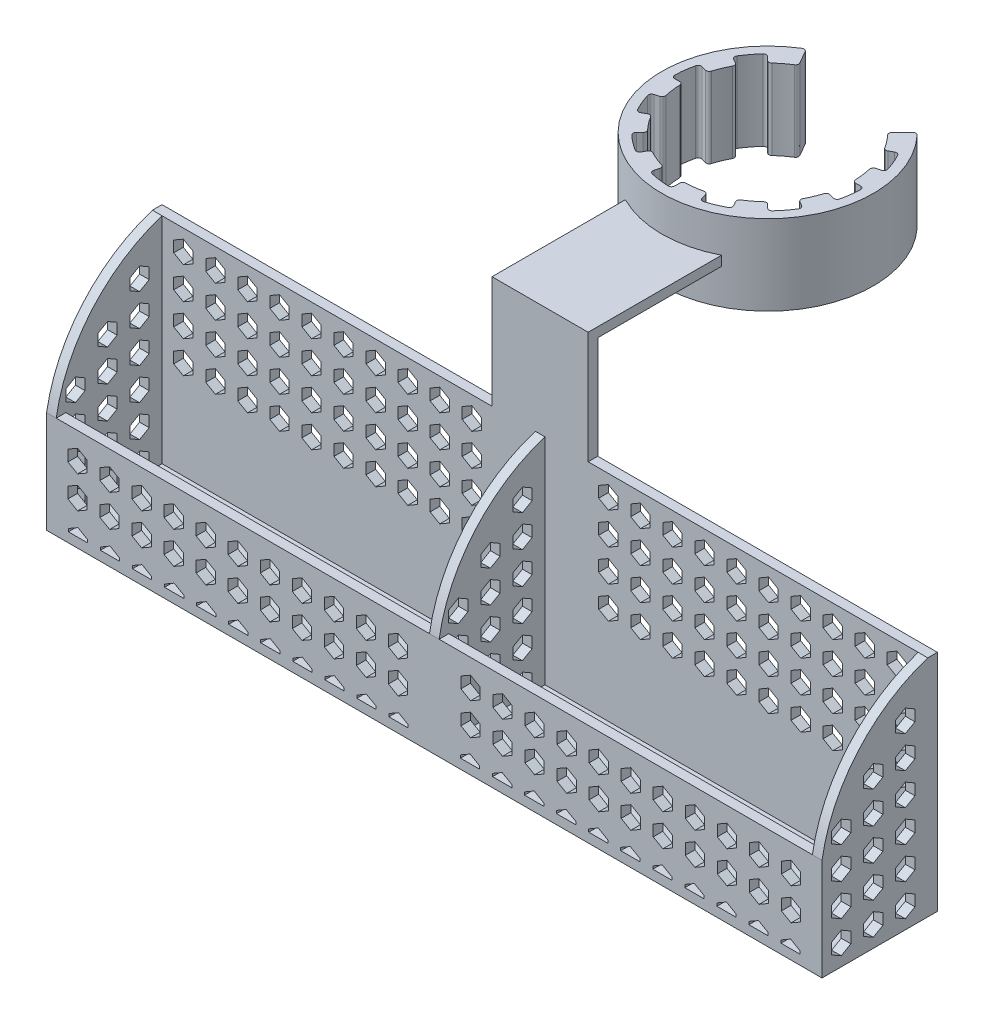
from build123d import *

# Parameters (mm, degrees)
BOSS_EXTRUDE1_DEPTH        = 25
BOSS_EXTRUDE2_REACH        = 89.943
BOSS_EXTRUDE2_START_RADIUS = 33
BOSS_EXTRUDE2_END_RADIUS   = 33
SKETCH4_W                  = 30
SKETCH4_H                  = 3
BOSS_EXTRUDE3_DEPTH        = 3
BOSS_EXTRUDE4_DEPTH        = 105
SKETCH9_W                  = 102.956738561
SKETCH9_H                  = 70
BOSS_EXTRUDE5_DEPTH        = 3
BOSS_EXTRUDE8_DEPTH        = 30
BOSS_EXTRUDE8_DEPTH_BACK   = 3
SKETCH14_W                 = 241.913477122
SKETCH14_H                 = 70
BOSS_EXTRUDE10_DEPTH       = 3
CUT_EXTRUDE1_DEPTH         = 30
CUT_EXTRUDE2_DEPTH         = 250
CUT_EXTRUDE3_REACH         = 202.968
SKETCH16_W                 = 235.913477122
SKETCH16_H                 = 12.238805489
SKETCH17_W                 = 241.913477122
SKETCH17_H                 = 1.732050807
BOSS_EXTRUDE11_DEPTH       = 3
SKETCH19_W                 = 3
SKETCH19_H                 = 33
BOSS_EXTRUDE12_DEPTH       = 67
CUT_EXTRUDE4_REACH         = 280.602
CUT_EXTRUDE5_DEPTH         = 259


with BuildPart() as part:
    # Sketch2 → Boss-Extrude1 (new body)
    with BuildSketch(Plane(origin=(0, 0, 0), x_dir=(1, 0, 0), z_dir=(0, 1, 0))):
        with BuildLine():
            Line((19.432575743, 19.432575743), (20.493901532, 20.493901532))
            Line((20.493901532, 20.493901532), (22.616365756, 22.616365756))
            ThreePointArc((22.616365756, 22.616365756), (23.339099445, 22.909136867), (24.052331054, 22.593923318))
            ThreePointArc((24.052331054, 22.593923318), (-4.307364343, -32.717680425), (-17.385030089, 28.049255405))
            ThreePointArc((-17.385030089, 28.049255405), (-16.614517988, 28.16913039), (-15.992185592, 27.699277969))
            Line((-15.992185592, 27.699277969), (-13.740906084, 23.799947479))
            ThreePointArc((-13.740906084, 23.799947479), (-13.636458805, 23.058736424), (-14.075770342, 22.452676662))
            ThreePointArc((-14.075770342, 22.452676662), (-16.132177869, 21.023863518), (-18.044542818, 19.407330432))
            ThreePointArc((-18.044542818, 19.407330432), (-18.743653787, 19.139847882), (-19.432575743, 19.432575743))
            Line((-19.432575743, 19.432575743), (-20.493901532, 20.493901532))
            ThreePointArc((-20.493901532, 20.493901532), (-21.218252256, 20.786646063), (-21.932077565, 20.469098018))
            ThreePointArc((-21.932077565, 20.469098018), (-23.800600209, 18.26284287), (-25.448069789, 15.886967741))
            ThreePointArc((-25.448069789, 15.886967741), (-25.570046062, 15.115277958), (-25.099800796, 14.491376746))
            Line((-25.099800796, 14.491376746), (-23.799947479, 13.740906084))
            ThreePointArc((-23.799947479, 13.740906084), (-23.338887955, 13.15122212), (-23.416313025, 12.406703201))
            ThreePointArc((-23.416313025, 12.406703201), (-24.482807612, 10.141110958), (-25.330697696, 7.784969765))
            ThreePointArc((-25.330697696, 7.784969765), (-25.80240428, 7.203767597), (-26.545392126, 7.112816383))
            Line((-26.545392126, 7.112816383), (-27.995190115, 7.501288583))
            ThreePointArc((-27.995190115, 7.501288583), (-28.768868509, 7.392637422), (-29.228285338, 6.760720094))
            ThreePointArc((-29.228285338, 6.760720094), (-29.743345841, 3.915785767), (-29.982158785, 1.034482759))
            ThreePointArc((-29.982158785, 1.034482759), (-29.701948445, 0.305191666), (-28.982753492, 0))
            Line((-28.982753492, 0), (-27.481812167, 0))
            ThreePointArc((-27.481812167, 0), (-26.787680925, -0.280151531), (-26.482473543, -0.963636364))
            ThreePointArc((-26.482473543, -0.963636364), (-26.273288826, -3.458944094), (-25.829512583, -5.923367264))
            ThreePointArc((-25.829512583, -5.923367264), (-25.947421383, -6.662556398), (-26.545392126, -7.112816383))
            Line((-26.545392126, -7.112816383), (-27.995190115, -7.501288583))
            ThreePointArc((-27.995190115, -7.501288583), (-28.610889678, -7.982222446), (-28.692797659, -8.75918732))
            ThreePointArc((-28.692797659, -8.75918732), (-27.716385975, -11.480502971), (-26.482552548, -14.095191044))
            ThreePointArc((-26.482552548, -14.095191044), (-25.875237728, -14.586670486), (-25.099800796, -14.491376746))
            Line((-25.099800796, -14.491376746), (-23.799947479, -13.740906084))
            ThreePointArc((-23.799947479, -13.740906084), (-23.058736424, -13.636458805), (-22.452676662, -14.075770342))
            ThreePointArc((-22.452676662, -14.075770342), (-21.023863518, -16.132177869), (-19.407330432, -18.044542818))
            ThreePointArc((-19.407330432, -18.044542818), (-19.139847882, -18.743653787), (-19.432575743, -19.432575743))
            Line((-19.432575743, -19.432575743), (-20.493901532, -20.493901532))
            ThreePointArc((-20.493901532, -20.493901532), (-20.786646063, -21.218252256), (-20.469098018, -21.932077565))
            ThreePointArc((-20.469098018, -21.932077565), (-18.26284287, -23.800600209), (-15.886967741, -25.448069789))
            ThreePointArc((-15.886967741, -25.448069789), (-15.115277958, -25.570046062), (-14.491376746, -25.099800796))
            Line((-14.491376746, -25.099800796), (-13.740906084, -23.799947479))
            ThreePointArc((-13.740906084, -23.799947479), (-13.15122212, -23.338887955), (-12.406703201, -23.416313025))
            ThreePointArc((-12.406703201, -23.416313025), (-10.141110958, -24.482807612), (-7.784969765, -25.330697696))
            ThreePointArc((-7.784969765, -25.330697696), (-7.203767597, -25.80240428), (-7.112816383, -26.545392126))
            Line((-7.112816383, -26.545392126), (-7.501288583, -27.995190115))
            ThreePointArc((-7.501288583, -27.995190115), (-7.392637422, -28.768868509), (-6.760720094, -29.228285338))
            ThreePointArc((-6.760720094, -29.228285338), (-3.915785767, -29.743345841), (-1.034482759, -29.982158785))
            ThreePointArc((-1.034482759, -29.982158785), (-0.305191666, -29.701948445), (0, -28.982753492))
            Line((0, -28.982753492), (0, -27.481812167))
            ThreePointArc((0, -27.481812167), (0.280151531, -26.787680925), (0.963636364, -26.482473543))
            ThreePointArc((0.963636364, -26.482473543), (3.458944094, -26.273288826), (5.923367264, -25.829512583))
            ThreePointArc((5.923367264, -25.829512583), (6.662556398, -25.947421383), (7.112816383, -26.545392126))
            Line((7.112816383, -26.545392126), (7.501288583, -27.995190115))
            ThreePointArc((7.501288583, -27.995190115), (7.982222446, -28.610889678), (8.75918732, -28.692797659))
            ThreePointArc((8.75918732, -28.692797659), (11.480502971, -27.716385975), (14.095191044, -26.482552548))
            ThreePointArc((14.095191044, -26.482552548), (14.586670486, -25.875237728), (14.491376746, -25.099800796))
            Line((14.491376746, -25.099800796), (13.740906084, -23.799947479))
            ThreePointArc((13.740906084, -23.799947479), (13.636458805, -23.058736424), (14.075770342, -22.452676662))
            ThreePointArc((14.075770342, -22.452676662), (16.132177869, -21.023863518), (18.044542818, -19.407330432))
            ThreePointArc((18.044542818, -19.407330432), (18.743653787, -19.139847882), (19.432575743, -19.432575743))
            Line((19.432575743, -19.432575743), (20.493901532, -20.493901532))
            ThreePointArc((20.493901532, -20.493901532), (21.218252256, -20.786646063), (21.932077565, -20.469098018))
            ThreePointArc((21.932077565, -20.469098018), (23.800600209, -18.26284287), (25.448069789, -15.886967741))
            ThreePointArc((25.448069789, -15.886967741), (25.570046062, -15.115277958), (25.099800796, -14.491376746))
            Line((25.099800796, -14.491376746), (23.799947479, -13.740906084))
            ThreePointArc((23.799947479, -13.740906084), (23.338887955, -13.15122212), (23.416313025, -12.406703201))
            ThreePointArc((23.416313025, -12.406703201), (24.482807612, -10.141110958), (25.330697696, -7.784969765))
            ThreePointArc((25.330697696, -7.784969765), (25.80240428, -7.203767597), (26.545392126, -7.112816383))
            Line((26.545392126, -7.112816383), (27.995190115, -7.501288583))
            ThreePointArc((27.995190115, -7.501288583), (28.768868509, -7.392637422), (29.228285338, -6.760720094))
            ThreePointArc((29.228285338, -6.760720094), (29.743345841, -3.915785767), (29.982158785, -1.034482759))
            ThreePointArc((29.982158785, -1.034482759), (29.701948445, -0.305191666), (28.982753492, 0))
            Line((28.982753492, 0), (27.481812167, 0))
            ThreePointArc((27.481812167, 0), (26.787680925, 0.280151531), (26.482473543, 0.963636364))
            ThreePointArc((26.482473543, 0.963636364), (26.273288826, 3.458944094), (25.829512583, 5.923367264))
            ThreePointArc((25.829512583, 5.923367264), (25.947421383, 6.662556398), (26.545392126, 7.112816383))
            Line((26.545392126, 7.112816383), (27.995190115, 7.501288583))
            ThreePointArc((27.995190115, 7.501288583), (28.610889678, 7.982222446), (28.692797659, 8.75918732))
            ThreePointArc((28.692797659, 8.75918732), (27.716385975, 11.480502971), (26.482552548, 14.095191044))
            ThreePointArc((26.482552548, 14.095191044), (25.875237728, 14.586670486), (25.099800796, 14.491376746))
            Line((25.099800796, 14.491376746), (23.799947479, 13.740906084))
            ThreePointArc((23.799947479, 13.740906084), (23.058736424, 13.636458805), (22.452676662, 14.075770342))
            ThreePointArc((22.452676662, 14.075770342), (21.023863518, 16.132177869), (19.407330432, 18.044542818))
            ThreePointArc((19.407330432, 18.044542818), (19.139847882, 18.743653787), (19.432575743, 19.432575743))
        make_face()
    extrude(amount=BOSS_EXTRUDE1_DEPTH)

    # Boss-Extrude2: from a cylinder face, 89.943 long prism both ways, kept between that surface and its translate by the depth
    boss_extrude2_start = Plane(origin=(0, 12.5, 0), z_dir=(0, -1, 0)) * Cylinder(BOSS_EXTRUDE2_START_RADIUS, 246.886, mode=Mode.PRIVATE)
    boss_extrude2_end = Plane(origin=(0, 12.5, 35), z_dir=(0, -1, 0)) * Cylinder(BOSS_EXTRUDE2_END_RADIUS, 246.886, mode=Mode.PRIVATE)
    # Sketch4 → Boss-Extrude2 (add, from a surface)
    with BuildSketch(Plane.XY, mode=Mode.PRIVATE) as boss_extrude2_sk1:
        with Locations((0, 12.5)):
            Rectangle(SKETCH4_W, SKETCH4_H)
    boss_extrude2_tool1 = extrude(boss_extrude2_sk1.sketch, amount=BOSS_EXTRUDE2_REACH, both=True, mode=Mode.PRIVATE)
    add(((boss_extrude2_tool1 - boss_extrude2_start) & boss_extrude2_end).solids().sort_by_distance((0, 12.5, 46.893877))[0])

    # Sketch5 → Boss-Extrude3 (add)
    with BuildSketch(Plane(origin=(0, 14, 0), x_dir=(1, 0, 0), z_dir=(0, 1, 0))):
        Polygon((0, -68), (-15, -68), (-15, -64.393876913), (15, -64.393876913), (15, -68), align=None)
    extrude(amount=-BOSS_EXTRUDE3_DEPTH)

    # Sketch6 → Boss-Extrude4 (add)
    with BuildSketch(Plane(origin=(0, 14, 0), x_dir=(1, 0, 0), z_dir=(0, 1, 0))):
        Polygon((0, -68), (-15, -68), (-15, -71), (15, -71), (15, -68), align=None)
    extrude(amount=-BOSS_EXTRUDE4_DEPTH)

    # Sketch9 → Boss-Extrude5 (add)
    # profile 1 of 2: a face of its own
    with BuildSketch(Plane.XY.offset(71)):
        with Locations((-66.478369281, -56)):
            Rectangle(SKETCH9_W, SKETCH9_H)
        Polygon((-101.299929178, -24), (-104.299929178, -25.732050808), (-104.299929178, -29.196152423), (-101.299929178, -30.92820323), (-98.299929178, -29.196152423), (-98.299929178, -25.732050808), align=None, mode=Mode.SUBTRACT)
        Polygon((-111.299929178, -24), (-114.299929178, -25.732050808), (-114.299929178, -29.196152423), (-111.299929178, -30.92820323), (-108.299929178, -29.196152423), (-108.299929178, -25.732050808), align=None, mode=Mode.SUBTRACT)
        Polygon((-91.299929178, -24), (-94.299929178, -25.732050808), (-94.299929178, -29.196152423), (-91.299929178, -30.92820323), (-88.299929178, -29.196152423), (-88.299929178, -25.732050808), align=None, mode=Mode.SUBTRACT)
        Polygon((-81.299929178, -24), (-84.299929178, -25.732050808), (-84.299929178, -29.196152423), (-81.299929178, -30.92820323), (-78.299929178, -29.196152423), (-78.299929178, -25.732050808), align=None, mode=Mode.SUBTRACT)
        Polygon((-71.299929178, -24), (-74.299929178, -25.732050808), (-74.299929178, -29.196152423), (-71.299929178, -30.92820323), (-68.299929178, -29.196152423), (-68.299929178, -25.732050808), align=None, mode=Mode.SUBTRACT)
        Polygon((-61.299929178, -24), (-64.299929178, -25.732050808), (-64.299929178, -29.196152423), (-61.299929178, -30.92820323), (-58.299929178, -29.196152423), (-58.299929178, -25.732050808), align=None, mode=Mode.SUBTRACT)
        Polygon((-51.299929178, -24), (-54.299929178, -25.732050808), (-54.299929178, -29.196152423), (-51.299929178, -30.92820323), (-48.299929178, -29.196152423), (-48.299929178, -25.732050808), align=None, mode=Mode.SUBTRACT)
        Polygon((-41.299929178, -24), (-44.299929178, -25.732050808), (-44.299929178, -29.196152423), (-41.299929178, -30.92820323), (-38.299929178, -29.196152423), (-38.299929178, -25.732050808), align=None, mode=Mode.SUBTRACT)
        Polygon((-31.299929178, -24), (-34.299929178, -25.732050808), (-34.299929178, -29.196152423), (-31.299929178, -30.92820323), (-28.299929178, -29.196152423), (-28.299929178, -25.732050808), align=None, mode=Mode.SUBTRACT)
        Polygon((-21.299929178, -24), (-24.299929178, -25.732050808), (-24.299929178, -29.196152423), (-21.299929178, -30.92820323), (-18.299929178, -29.196152423), (-18.299929178, -25.732050808), align=None, mode=Mode.SUBTRACT)
        Polygon((-101.299929178, -34), (-104.299929178, -35.732050808), (-104.299929178, -39.196152423), (-101.299929178, -40.92820323), (-98.299929178, -39.196152423), (-98.299929178, -35.732050808), align=None, mode=Mode.SUBTRACT)
        Polygon((-91.299929178, -34), (-94.299929178, -35.732050808), (-94.299929178, -39.196152423), (-91.299929178, -40.92820323), (-88.299929178, -39.196152423), (-88.299929178, -35.732050808), align=None, mode=Mode.SUBTRACT)
        Polygon((-81.299929178, -34), (-84.299929178, -35.732050808), (-84.299929178, -39.196152423), (-81.299929178, -40.92820323), (-78.299929178, -39.196152423), (-78.299929178, -35.732050808), align=None, mode=Mode.SUBTRACT)
        Polygon((-71.299929178, -34), (-74.299929178, -35.732050808), (-74.299929178, -39.196152423), (-71.299929178, -40.92820323), (-68.299929178, -39.196152423), (-68.299929178, -35.732050808), align=None, mode=Mode.SUBTRACT)
        Polygon((-61.299929178, -34), (-64.299929178, -35.732050808), (-64.299929178, -39.196152423), (-61.299929178, -40.92820323), (-58.299929178, -39.196152423), (-58.299929178, -35.732050808), align=None, mode=Mode.SUBTRACT)
        Polygon((-51.299929178, -34), (-54.299929178, -35.732050808), (-54.299929178, -39.196152423), (-51.299929178, -40.92820323), (-48.299929178, -39.196152423), (-48.299929178, -35.732050808), align=None, mode=Mode.SUBTRACT)
        Polygon((-41.299929178, -34), (-44.299929178, -35.732050808), (-44.299929178, -39.196152423), (-41.299929178, -40.92820323), (-38.299929178, -39.196152423), (-38.299929178, -35.732050808), align=None, mode=Mode.SUBTRACT)
        Polygon((-31.299929178, -34), (-34.299929178, -35.732050808), (-34.299929178, -39.196152423), (-31.299929178, -40.92820323), (-28.299929178, -39.196152423), (-28.299929178, -35.732050808), align=None, mode=Mode.SUBTRACT)
        Polygon((-21.299929178, -34), (-24.299929178, -35.732050808), (-24.299929178, -39.196152423), (-21.299929178, -40.92820323), (-18.299929178, -39.196152423), (-18.299929178, -35.732050808), align=None, mode=Mode.SUBTRACT)
        Polygon((-101.299929178, -44), (-104.299929178, -45.732050808), (-104.299929178, -49.196152423), (-101.299929178, -50.92820323), (-98.299929178, -49.196152423), (-98.299929178, -45.732050808), align=None, mode=Mode.SUBTRACT)
        Polygon((-91.299929178, -44), (-94.299929178, -45.732050808), (-94.299929178, -49.196152423), (-91.299929178, -50.92820323), (-88.299929178, -49.196152423), (-88.299929178, -45.732050808), align=None, mode=Mode.SUBTRACT)
        Polygon((-81.299929178, -44), (-84.299929178, -45.732050808), (-84.299929178, -49.196152423), (-81.299929178, -50.92820323), (-78.299929178, -49.196152423), (-78.299929178, -45.732050808), align=None, mode=Mode.SUBTRACT)
        Polygon((-71.299929178, -44), (-74.299929178, -45.732050808), (-74.299929178, -49.196152423), (-71.299929178, -50.92820323), (-68.299929178, -49.196152423), (-68.299929178, -45.732050808), align=None, mode=Mode.SUBTRACT)
        Polygon((-61.299929178, -44), (-64.299929178, -45.732050808), (-64.299929178, -49.196152423), (-61.299929178, -50.92820323), (-58.299929178, -49.196152423), (-58.299929178, -45.732050808), align=None, mode=Mode.SUBTRACT)
        Polygon((-51.299929178, -44), (-54.299929178, -45.732050808), (-54.299929178, -49.196152423), (-51.299929178, -50.92820323), (-48.299929178, -49.196152423), (-48.299929178, -45.732050808), align=None, mode=Mode.SUBTRACT)
        Polygon((-41.299929178, -44), (-44.299929178, -45.732050808), (-44.299929178, -49.196152423), (-41.299929178, -50.92820323), (-38.299929178, -49.196152423), (-38.299929178, -45.732050808), align=None, mode=Mode.SUBTRACT)
        Polygon((-31.299929178, -44), (-34.299929178, -45.732050808), (-34.299929178, -49.196152423), (-31.299929178, -50.92820323), (-28.299929178, -49.196152423), (-28.299929178, -45.732050808), align=None, mode=Mode.SUBTRACT)
        Polygon((-21.299929178, -44), (-24.299929178, -45.732050808), (-24.299929178, -49.196152423), (-21.299929178, -50.92820323), (-18.299929178, -49.196152423), (-18.299929178, -45.732050808), align=None, mode=Mode.SUBTRACT)
        Polygon((-101.299929178, -54), (-104.299929178, -55.732050808), (-104.299929178, -59.196152423), (-101.299929178, -60.92820323), (-98.299929178, -59.196152423), (-98.299929178, -55.732050808), align=None, mode=Mode.SUBTRACT)
        Polygon((-91.299929178, -54), (-94.299929178, -55.732050808), (-94.299929178, -59.196152423), (-91.299929178, -60.92820323), (-88.299929178, -59.196152423), (-88.299929178, -55.732050808), align=None, mode=Mode.SUBTRACT)
        Polygon((-81.299929178, -54), (-84.299929178, -55.732050808), (-84.299929178, -59.196152423), (-81.299929178, -60.92820323), (-78.299929178, -59.196152423), (-78.299929178, -55.732050808), align=None, mode=Mode.SUBTRACT)
        Polygon((-71.299929178, -54), (-74.299929178, -55.732050808), (-74.299929178, -59.196152423), (-71.299929178, -60.92820323), (-68.299929178, -59.196152423), (-68.299929178, -55.732050808), align=None, mode=Mode.SUBTRACT)
        Polygon((-61.299929178, -54), (-64.299929178, -55.732050808), (-64.299929178, -59.196152423), (-61.299929178, -60.92820323), (-58.299929178, -59.196152423), (-58.299929178, -55.732050808), align=None, mode=Mode.SUBTRACT)
        Polygon((-51.299929178, -54), (-54.299929178, -55.732050808), (-54.299929178, -59.196152423), (-51.299929178, -60.92820323), (-48.299929178, -59.196152423), (-48.299929178, -55.732050808), align=None, mode=Mode.SUBTRACT)
        Polygon((-41.299929178, -54), (-44.299929178, -55.732050808), (-44.299929178, -59.196152423), (-41.299929178, -60.92820323), (-38.299929178, -59.196152423), (-38.299929178, -55.732050808), align=None, mode=Mode.SUBTRACT)
        Polygon((-31.299929178, -54), (-34.299929178, -55.732050808), (-34.299929178, -59.196152423), (-31.299929178, -60.92820323), (-28.299929178, -59.196152423), (-28.299929178, -55.732050808), align=None, mode=Mode.SUBTRACT)
        Polygon((-21.299929178, -54), (-24.299929178, -55.732050808), (-24.299929178, -59.196152423), (-21.299929178, -60.92820323), (-18.299929178, -59.196152423), (-18.299929178, -55.732050808), align=None, mode=Mode.SUBTRACT)
        Polygon((-111.299929178, -34), (-114.299929178, -35.732050808), (-114.299929178, -39.196152423), (-111.299929178, -40.92820323), (-108.299929178, -39.196152423), (-108.299929178, -35.732050808), align=None, mode=Mode.SUBTRACT)
        Polygon((-111.299929178, -44), (-114.299929178, -45.732050808), (-114.299929178, -49.196152423), (-111.299929178, -50.92820323), (-108.299929178, -49.196152423), (-108.299929178, -45.732050808), align=None, mode=Mode.SUBTRACT)
        Polygon((-111.299929178, -54), (-114.299929178, -55.732050808), (-114.299929178, -59.196152423), (-111.299929178, -60.92820323), (-108.299929178, -59.196152423), (-108.299929178, -55.732050808), align=None, mode=Mode.SUBTRACT)
    # profile 2 of 2: a face of its own
    with BuildSketch(Plane.XY.offset(71)):
        with Locations((66.478369281, -56)):
            Rectangle(SKETCH9_W, SKETCH9_H)
        Polygon((108.299929178, -55.732050808), (111.299929178, -54), (114.299929178, -55.732050808), (114.299929178, -59.196152423), (111.299929178, -60.92820323), (108.299929178, -59.196152423), align=None, mode=Mode.SUBTRACT)
        Polygon((108.299929178, -45.732050808), (111.299929178, -44), (114.299929178, -45.732050808), (114.299929178, -49.196152423), (111.299929178, -50.92820323), (108.299929178, -49.196152423), align=None, mode=Mode.SUBTRACT)
        Polygon((108.299929178, -35.732050808), (111.299929178, -34), (114.299929178, -35.732050808), (114.299929178, -39.196152423), (111.299929178, -40.92820323), (108.299929178, -39.196152423), align=None, mode=Mode.SUBTRACT)
        Polygon((18.299929178, -55.732050808), (21.299929178, -54), (24.299929178, -55.732050808), (24.299929178, -59.196152423), (21.299929178, -60.92820323), (18.299929178, -59.196152423), align=None, mode=Mode.SUBTRACT)
        Polygon((28.299929178, -55.732050808), (31.299929178, -54), (34.299929178, -55.732050808), (34.299929178, -59.196152423), (31.299929178, -60.92820323), (28.299929178, -59.196152423), align=None, mode=Mode.SUBTRACT)
        Polygon((38.299929178, -55.732050808), (41.299929178, -54), (44.299929178, -55.732050808), (44.299929178, -59.196152423), (41.299929178, -60.92820323), (38.299929178, -59.196152423), align=None, mode=Mode.SUBTRACT)
        Polygon((48.299929178, -55.732050808), (51.299929178, -54), (54.299929178, -55.732050808), (54.299929178, -59.196152423), (51.299929178, -60.92820323), (48.299929178, -59.196152423), align=None, mode=Mode.SUBTRACT)
        Polygon((58.299929178, -55.732050808), (61.299929178, -54), (64.299929178, -55.732050808), (64.299929178, -59.196152423), (61.299929178, -60.92820323), (58.299929178, -59.196152423), align=None, mode=Mode.SUBTRACT)
        Polygon((68.299929178, -55.732050808), (71.299929178, -54), (74.299929178, -55.732050808), (74.299929178, -59.196152423), (71.299929178, -60.92820323), (68.299929178, -59.196152423), align=None, mode=Mode.SUBTRACT)
        Polygon((78.299929178, -55.732050808), (81.299929178, -54), (84.299929178, -55.732050808), (84.299929178, -59.196152423), (81.299929178, -60.92820323), (78.299929178, -59.196152423), align=None, mode=Mode.SUBTRACT)
        Polygon((88.299929178, -55.732050808), (91.299929178, -54), (94.299929178, -55.732050808), (94.299929178, -59.196152423), (91.299929178, -60.92820323), (88.299929178, -59.196152423), align=None, mode=Mode.SUBTRACT)
        Polygon((98.299929178, -55.732050808), (101.299929178, -54), (104.299929178, -55.732050808), (104.299929178, -59.196152423), (101.299929178, -60.92820323), (98.299929178, -59.196152423), align=None, mode=Mode.SUBTRACT)
        Polygon((18.299929178, -45.732050808), (21.299929178, -44), (24.299929178, -45.732050808), (24.299929178, -49.196152423), (21.299929178, -50.92820323), (18.299929178, -49.196152423), align=None, mode=Mode.SUBTRACT)
        Polygon((28.299929178, -45.732050808), (31.299929178, -44), (34.299929178, -45.732050808), (34.299929178, -49.196152423), (31.299929178, -50.92820323), (28.299929178, -49.196152423), align=None, mode=Mode.SUBTRACT)
        Polygon((38.299929178, -45.732050808), (41.299929178, -44), (44.299929178, -45.732050808), (44.299929178, -49.196152423), (41.299929178, -50.92820323), (38.299929178, -49.196152423), align=None, mode=Mode.SUBTRACT)
        Polygon((48.299929178, -45.732050808), (51.299929178, -44), (54.299929178, -45.732050808), (54.299929178, -49.196152423), (51.299929178, -50.92820323), (48.299929178, -49.196152423), align=None, mode=Mode.SUBTRACT)
        Polygon((58.299929178, -45.732050808), (61.299929178, -44), (64.299929178, -45.732050808), (64.299929178, -49.196152423), (61.299929178, -50.92820323), (58.299929178, -49.196152423), align=None, mode=Mode.SUBTRACT)
        Polygon((68.299929178, -45.732050808), (71.299929178, -44), (74.299929178, -45.732050808), (74.299929178, -49.196152423), (71.299929178, -50.92820323), (68.299929178, -49.196152423), align=None, mode=Mode.SUBTRACT)
        Polygon((78.299929178, -45.732050808), (81.299929178, -44), (84.299929178, -45.732050808), (84.299929178, -49.196152423), (81.299929178, -50.92820323), (78.299929178, -49.196152423), align=None, mode=Mode.SUBTRACT)
        Polygon((88.299929178, -45.732050808), (91.299929178, -44), (94.299929178, -45.732050808), (94.299929178, -49.196152423), (91.299929178, -50.92820323), (88.299929178, -49.196152423), align=None, mode=Mode.SUBTRACT)
        Polygon((98.299929178, -45.732050808), (101.299929178, -44), (104.299929178, -45.732050808), (104.299929178, -49.196152423), (101.299929178, -50.92820323), (98.299929178, -49.196152423), align=None, mode=Mode.SUBTRACT)
        Polygon((18.299929178, -35.732050808), (21.299929178, -34), (24.299929178, -35.732050808), (24.299929178, -39.196152423), (21.299929178, -40.92820323), (18.299929178, -39.196152423), align=None, mode=Mode.SUBTRACT)
        Polygon((28.299929178, -35.732050808), (31.299929178, -34), (34.299929178, -35.732050808), (34.299929178, -39.196152423), (31.299929178, -40.92820323), (28.299929178, -39.196152423), align=None, mode=Mode.SUBTRACT)
        Polygon((38.299929178, -35.732050808), (41.299929178, -34), (44.299929178, -35.732050808), (44.299929178, -39.196152423), (41.299929178, -40.92820323), (38.299929178, -39.196152423), align=None, mode=Mode.SUBTRACT)
        Polygon((48.299929178, -35.732050808), (51.299929178, -34), (54.299929178, -35.732050808), (54.299929178, -39.196152423), (51.299929178, -40.92820323), (48.299929178, -39.196152423), align=None, mode=Mode.SUBTRACT)
        Polygon((58.299929178, -35.732050808), (61.299929178, -34), (64.299929178, -35.732050808), (64.299929178, -39.196152423), (61.299929178, -40.92820323), (58.299929178, -39.196152423), align=None, mode=Mode.SUBTRACT)
        Polygon((68.299929178, -35.732050808), (71.299929178, -34), (74.299929178, -35.732050808), (74.299929178, -39.196152423), (71.299929178, -40.92820323), (68.299929178, -39.196152423), align=None, mode=Mode.SUBTRACT)
        Polygon((78.299929178, -35.732050808), (81.299929178, -34), (84.299929178, -35.732050808), (84.299929178, -39.196152423), (81.299929178, -40.92820323), (78.299929178, -39.196152423), align=None, mode=Mode.SUBTRACT)
        Polygon((88.299929178, -35.732050808), (91.299929178, -34), (94.299929178, -35.732050808), (94.299929178, -39.196152423), (91.299929178, -40.92820323), (88.299929178, -39.196152423), align=None, mode=Mode.SUBTRACT)
        Polygon((98.299929178, -35.732050808), (101.299929178, -34), (104.299929178, -35.732050808), (104.299929178, -39.196152423), (101.299929178, -40.92820323), (98.299929178, -39.196152423), align=None, mode=Mode.SUBTRACT)
        Polygon((18.299929178, -25.732050808), (21.299929178, -24), (24.299929178, -25.732050808), (24.299929178, -29.196152423), (21.299929178, -30.92820323), (18.299929178, -29.196152423), align=None, mode=Mode.SUBTRACT)
        Polygon((28.299929178, -25.732050808), (31.299929178, -24), (34.299929178, -25.732050808), (34.299929178, -29.196152423), (31.299929178, -30.92820323), (28.299929178, -29.196152423), align=None, mode=Mode.SUBTRACT)
        Polygon((38.299929178, -25.732050808), (41.299929178, -24), (44.299929178, -25.732050808), (44.299929178, -29.196152423), (41.299929178, -30.92820323), (38.299929178, -29.196152423), align=None, mode=Mode.SUBTRACT)
        Polygon((48.299929178, -25.732050808), (51.299929178, -24), (54.299929178, -25.732050808), (54.299929178, -29.196152423), (51.299929178, -30.92820323), (48.299929178, -29.196152423), align=None, mode=Mode.SUBTRACT)
        Polygon((58.299929178, -25.732050808), (61.299929178, -24), (64.299929178, -25.732050808), (64.299929178, -29.196152423), (61.299929178, -30.92820323), (58.299929178, -29.196152423), align=None, mode=Mode.SUBTRACT)
        Polygon((68.299929178, -25.732050808), (71.299929178, -24), (74.299929178, -25.732050808), (74.299929178, -29.196152423), (71.299929178, -30.92820323), (68.299929178, -29.196152423), align=None, mode=Mode.SUBTRACT)
        Polygon((78.299929178, -25.732050808), (81.299929178, -24), (84.299929178, -25.732050808), (84.299929178, -29.196152423), (81.299929178, -30.92820323), (78.299929178, -29.196152423), align=None, mode=Mode.SUBTRACT)
        Polygon((88.299929178, -25.732050808), (91.299929178, -24), (94.299929178, -25.732050808), (94.299929178, -29.196152423), (91.299929178, -30.92820323), (88.299929178, -29.196152423), align=None, mode=Mode.SUBTRACT)
        Polygon((98.299929178, -25.732050808), (101.299929178, -24), (104.299929178, -25.732050808), (104.299929178, -29.196152423), (101.299929178, -30.92820323), (98.299929178, -29.196152423), align=None, mode=Mode.SUBTRACT)
        Polygon((108.299929178, -25.732050808), (111.299929178, -24), (114.299929178, -25.732050808), (114.299929178, -29.196152423), (111.299929178, -30.92820323), (108.299929178, -29.196152423), align=None, mode=Mode.SUBTRACT)
    extrude(amount=-BOSS_EXTRUDE5_DEPTH)

    # Sketch10 → Boss-Extrude8 (add, two sides: drawn at the far end of the back side and taken through both)
    with BuildSketch(Plane.XY.offset(71).offset(-BOSS_EXTRUDE8_DEPTH_BACK)):
        Polygon((-117.956738561, -91), (117.956738561, -91), (120.956738561, -91), (120.956738561, -21), (117.956738561, -21), (117.956738561, -88), (-117.956738561, -88), (-117.956738561, -21), (-120.956738561, -21), (-120.956738561, -91), align=None)
    extrude(amount=BOSS_EXTRUDE8_DEPTH + BOSS_EXTRUDE8_DEPTH_BACK)

    # Sketch14 → Boss-Extrude10 (add)
    with BuildSketch(Plane.XY.offset(101)):
        with Locations((0, -56)):
            Rectangle(SKETCH14_W, SKETCH14_H)
    extrude(amount=BOSS_EXTRUDE10_DEPTH)

    # Sketch12 → Cut-Extrude1 (cut)
    with BuildSketch(Plane.XY.offset(101)):
        Polygon((-98.299929178, -25.732050808), (-101.299929178, -24), (-104.299929178, -25.732050808), (-104.299929178, -29.196152423), (-101.299929178, -30.92820323), (-98.299929178, -29.196152423), align=None)
        Polygon((-108.299929178, -25.732050808), (-111.299929178, -24), (-114.299929178, -25.732050808), (-114.299929178, -29.196152423), (-111.299929178, -30.92820323), (-108.299929178, -29.196152423), align=None)
        Polygon((-88.299929178, -25.732050808), (-91.299929178, -24), (-94.299929178, -25.732050808), (-94.299929178, -29.196152423), (-91.299929178, -30.92820323), (-88.299929178, -29.196152423), align=None)
        Polygon((-78.299929178, -25.732050808), (-81.299929178, -24), (-84.299929178, -25.732050808), (-84.299929178, -29.196152423), (-81.299929178, -30.92820323), (-78.299929178, -29.196152423), align=None)
        Polygon((-68.299929178, -25.732050808), (-71.299929178, -24), (-74.299929178, -25.732050808), (-74.299929178, -29.196152423), (-71.299929178, -30.92820323), (-68.299929178, -29.196152423), align=None)
        Polygon((-58.299929178, -25.732050808), (-61.299929178, -24), (-64.299929178, -25.732050808), (-64.299929178, -29.196152423), (-61.299929178, -30.92820323), (-58.299929178, -29.196152423), align=None)
        Polygon((-48.299929178, -25.732050808), (-51.299929178, -24), (-54.299929178, -25.732050808), (-54.299929178, -29.196152423), (-51.299929178, -30.92820323), (-48.299929178, -29.196152423), align=None)
        Polygon((-38.299929178, -25.732050808), (-41.299929178, -24), (-44.299929178, -25.732050808), (-44.299929178, -29.196152423), (-41.299929178, -30.92820323), (-38.299929178, -29.196152423), align=None)
        Polygon((-28.299929178, -25.732050808), (-31.299929178, -24), (-34.299929178, -25.732050808), (-34.299929178, -29.196152423), (-31.299929178, -30.92820323), (-28.299929178, -29.196152423), align=None)
        Polygon((-18.299929178, -25.732050808), (-21.299929178, -24), (-24.299929178, -25.732050808), (-24.299929178, -29.196152423), (-21.299929178, -30.92820323), (-18.299929178, -29.196152423), align=None)
        Polygon((-8.299929178, -25.732050808), (-11.299929178, -24), (-14.299929178, -25.732050808), (-14.299929178, -29.196152423), (-11.299929178, -30.92820323), (-8.299929178, -29.196152423), align=None)
        Polygon((-98.299929178, -35.732050808), (-101.299929178, -34), (-104.299929178, -35.732050808), (-104.299929178, -39.196152423), (-101.299929178, -40.92820323), (-98.299929178, -39.196152423), align=None)
        Polygon((-88.299929178, -35.732050808), (-91.299929178, -34), (-94.299929178, -35.732050808), (-94.299929178, -39.196152423), (-91.299929178, -40.92820323), (-88.299929178, -39.196152423), align=None)
        Polygon((-78.299929178, -35.732050808), (-81.299929178, -34), (-84.299929178, -35.732050808), (-84.299929178, -39.196152423), (-81.299929178, -40.92820323), (-78.299929178, -39.196152423), align=None)
        Polygon((-68.299929178, -35.732050808), (-71.299929178, -34), (-74.299929178, -35.732050808), (-74.299929178, -39.196152423), (-71.299929178, -40.92820323), (-68.299929178, -39.196152423), align=None)
        Polygon((-58.299929178, -35.732050808), (-61.299929178, -34), (-64.299929178, -35.732050808), (-64.299929178, -39.196152423), (-61.299929178, -40.92820323), (-58.299929178, -39.196152423), align=None)
        Polygon((-48.299929178, -35.732050808), (-51.299929178, -34), (-54.299929178, -35.732050808), (-54.299929178, -39.196152423), (-51.299929178, -40.92820323), (-48.299929178, -39.196152423), align=None)
        Polygon((-38.299929178, -35.732050808), (-41.299929178, -34), (-44.299929178, -35.732050808), (-44.299929178, -39.196152423), (-41.299929178, -40.92820323), (-38.299929178, -39.196152423), align=None)
        Polygon((-28.299929178, -35.732050808), (-31.299929178, -34), (-34.299929178, -35.732050808), (-34.299929178, -39.196152423), (-31.299929178, -40.92820323), (-28.299929178, -39.196152423), align=None)
        Polygon((-18.299929178, -35.732050808), (-21.299929178, -34), (-24.299929178, -35.732050808), (-24.299929178, -39.196152423), (-21.299929178, -40.92820323), (-18.299929178, -39.196152423), align=None)
        Polygon((-8.299929178, -35.732050808), (-11.299929178, -34), (-14.299929178, -35.732050808), (-14.299929178, -39.196152423), (-11.299929178, -40.92820323), (-8.299929178, -39.196152423), align=None)
        Polygon((-98.299929178, -45.732050808), (-101.299929178, -44), (-104.299929178, -45.732050808), (-104.299929178, -49.196152423), (-101.299929178, -50.92820323), (-98.299929178, -49.196152423), align=None)
        Polygon((-88.299929178, -45.732050808), (-91.299929178, -44), (-94.299929178, -45.732050808), (-94.299929178, -49.196152423), (-91.299929178, -50.92820323), (-88.299929178, -49.196152423), align=None)
        Polygon((-78.299929178, -45.732050808), (-81.299929178, -44), (-84.299929178, -45.732050808), (-84.299929178, -49.196152423), (-81.299929178, -50.92820323), (-78.299929178, -49.196152423), align=None)
        Polygon((-68.299929178, -45.732050808), (-71.299929178, -44), (-74.299929178, -45.732050808), (-74.299929178, -49.196152423), (-71.299929178, -50.92820323), (-68.299929178, -49.196152423), align=None)
        Polygon((-58.299929178, -45.732050808), (-61.299929178, -44), (-64.299929178, -45.732050808), (-64.299929178, -49.196152423), (-61.299929178, -50.92820323), (-58.299929178, -49.196152423), align=None)
        Polygon((-48.299929178, -45.732050808), (-51.299929178, -44), (-54.299929178, -45.732050808), (-54.299929178, -49.196152423), (-51.299929178, -50.92820323), (-48.299929178, -49.196152423), align=None)
        Polygon((-38.299929178, -45.732050808), (-41.299929178, -44), (-44.299929178, -45.732050808), (-44.299929178, -49.196152423), (-41.299929178, -50.92820323), (-38.299929178, -49.196152423), align=None)
        Polygon((-28.299929178, -45.732050808), (-31.299929178, -44), (-34.299929178, -45.732050808), (-34.299929178, -49.196152423), (-31.299929178, -50.92820323), (-28.299929178, -49.196152423), align=None)
        Polygon((-18.299929178, -45.732050808), (-21.299929178, -44), (-24.299929178, -45.732050808), (-24.299929178, -49.196152423), (-21.299929178, -50.92820323), (-18.299929178, -49.196152423), align=None)
        Polygon((-8.299929178, -45.732050808), (-11.299929178, -44), (-14.299929178, -45.732050808), (-14.299929178, -49.196152423), (-11.299929178, -50.92820323), (-8.299929178, -49.196152423), align=None)
        Polygon((-98.299929178, -55.732050808), (-101.299929178, -54), (-104.299929178, -55.732050808), (-104.299929178, -59.196152423), (-101.299929178, -60.92820323), (-98.299929178, -59.196152423), align=None)
        Polygon((-88.299929178, -55.732050808), (-91.299929178, -54), (-94.299929178, -55.732050808), (-94.299929178, -59.196152423), (-91.299929178, -60.92820323), (-88.299929178, -59.196152423), align=None)
        Polygon((-78.299929178, -55.732050808), (-81.299929178, -54), (-84.299929178, -55.732050808), (-84.299929178, -59.196152423), (-81.299929178, -60.92820323), (-78.299929178, -59.196152423), align=None)
        Polygon((-68.299929178, -55.732050808), (-71.299929178, -54), (-74.299929178, -55.732050808), (-74.299929178, -59.196152423), (-71.299929178, -60.92820323), (-68.299929178, -59.196152423), align=None)
        Polygon((-58.299929178, -55.732050808), (-61.299929178, -54), (-64.299929178, -55.732050808), (-64.299929178, -59.196152423), (-61.299929178, -60.92820323), (-58.299929178, -59.196152423), align=None)
        Polygon((-48.299929178, -55.732050808), (-51.299929178, -54), (-54.299929178, -55.732050808), (-54.299929178, -59.196152423), (-51.299929178, -60.92820323), (-48.299929178, -59.196152423), align=None)
        Polygon((-38.299929178, -55.732050808), (-41.299929178, -54), (-44.299929178, -55.732050808), (-44.299929178, -59.196152423), (-41.299929178, -60.92820323), (-38.299929178, -59.196152423), align=None)
        Polygon((-28.299929178, -55.732050808), (-31.299929178, -54), (-34.299929178, -55.732050808), (-34.299929178, -59.196152423), (-31.299929178, -60.92820323), (-28.299929178, -59.196152423), align=None)
        Polygon((-18.299929178, -55.732050808), (-21.299929178, -54), (-24.299929178, -55.732050808), (-24.299929178, -59.196152423), (-21.299929178, -60.92820323), (-18.299929178, -59.196152423), align=None)
        Polygon((-8.299929178, -55.732050808), (-11.299929178, -54), (-14.299929178, -55.732050808), (-14.299929178, -59.196152423), (-11.299929178, -60.92820323), (-8.299929178, -59.196152423), align=None)
        Polygon((-98.299929178, -65.732050808), (-101.299929178, -64), (-104.299929178, -65.732050808), (-104.299929178, -69.196152423), (-101.299929178, -70.92820323), (-98.299929178, -69.196152423), align=None)
        Polygon((-88.299929178, -65.732050808), (-91.299929178, -64), (-94.299929178, -65.732050808), (-94.299929178, -69.196152423), (-91.299929178, -70.92820323), (-88.299929178, -69.196152423), align=None)
        Polygon((-78.299929178, -65.732050808), (-81.299929178, -64), (-84.299929178, -65.732050808), (-84.299929178, -69.196152423), (-81.299929178, -70.92820323), (-78.299929178, -69.196152423), align=None)
        Polygon((-68.299929178, -65.732050808), (-71.299929178, -64), (-74.299929178, -65.732050808), (-74.299929178, -69.196152423), (-71.299929178, -70.92820323), (-68.299929178, -69.196152423), align=None)
        Polygon((-58.299929178, -65.732050808), (-61.299929178, -64), (-64.299929178, -65.732050808), (-64.299929178, -69.196152423), (-61.299929178, -70.92820323), (-58.299929178, -69.196152423), align=None)
        Polygon((-48.299929178, -65.732050808), (-51.299929178, -64), (-54.299929178, -65.732050808), (-54.299929178, -69.196152423), (-51.299929178, -70.92820323), (-48.299929178, -69.196152423), align=None)
        Polygon((-38.299929178, -65.732050808), (-41.299929178, -64), (-44.299929178, -65.732050808), (-44.299929178, -69.196152423), (-41.299929178, -70.92820323), (-38.299929178, -69.196152423), align=None)
        Polygon((-28.299929178, -65.732050808), (-31.299929178, -64), (-34.299929178, -65.732050808), (-34.299929178, -69.196152423), (-31.299929178, -70.92820323), (-28.299929178, -69.196152423), align=None)
        Polygon((-18.299929178, -65.732050808), (-21.299929178, -64), (-24.299929178, -65.732050808), (-24.299929178, -69.196152423), (-21.299929178, -70.92820323), (-18.299929178, -69.196152423), align=None)
        Polygon((-8.299929178, -65.732050808), (-11.299929178, -64), (-14.299929178, -65.732050808), (-14.299929178, -69.196152423), (-11.299929178, -70.92820323), (-8.299929178, -69.196152423), align=None)
        Polygon((-98.299929178, -75.732050808), (-101.299929178, -74), (-104.299929178, -75.732050808), (-104.299929178, -79.196152423), (-101.299929178, -80.92820323), (-98.299929178, -79.196152423), align=None)
        Polygon((-88.299929178, -75.732050808), (-91.299929178, -74), (-94.299929178, -75.732050808), (-94.299929178, -79.196152423), (-91.299929178, -80.92820323), (-88.299929178, -79.196152423), align=None)
        Polygon((-78.299929178, -75.732050808), (-81.299929178, -74), (-84.299929178, -75.732050808), (-84.299929178, -79.196152423), (-81.299929178, -80.92820323), (-78.299929178, -79.196152423), align=None)
        Polygon((-68.299929178, -75.732050808), (-71.299929178, -74), (-74.299929178, -75.732050808), (-74.299929178, -79.196152423), (-71.299929178, -80.92820323), (-68.299929178, -79.196152423), align=None)
        Polygon((-58.299929178, -75.732050808), (-61.299929178, -74), (-64.299929178, -75.732050808), (-64.299929178, -79.196152423), (-61.299929178, -80.92820323), (-58.299929178, -79.196152423), align=None)
        Polygon((-48.299929178, -75.732050808), (-51.299929178, -74), (-54.299929178, -75.732050808), (-54.299929178, -79.196152423), (-51.299929178, -80.92820323), (-48.299929178, -79.196152423), align=None)
        Polygon((-38.299929178, -75.732050808), (-41.299929178, -74), (-44.299929178, -75.732050808), (-44.299929178, -79.196152423), (-41.299929178, -80.92820323), (-38.299929178, -79.196152423), align=None)
        Polygon((-28.299929178, -75.732050808), (-31.299929178, -74), (-34.299929178, -75.732050808), (-34.299929178, -79.196152423), (-31.299929178, -80.92820323), (-28.299929178, -79.196152423), align=None)
        Polygon((-18.299929178, -75.732050808), (-21.299929178, -74), (-24.299929178, -75.732050808), (-24.299929178, -79.196152423), (-21.299929178, -80.92820323), (-18.299929178, -79.196152423), align=None)
        Polygon((-8.299929178, -75.732050808), (-11.299929178, -74), (-14.299929178, -75.732050808), (-14.299929178, -79.196152423), (-11.299929178, -80.92820323), (-8.299929178, -79.196152423), align=None)
        Polygon((-108.299929178, -35.732050808), (-111.299929178, -34), (-114.299929178, -35.732050808), (-114.299929178, -39.196152423), (-111.299929178, -40.92820323), (-108.299929178, -39.196152423), align=None)
        Polygon((-108.299929178, -45.732050808), (-111.299929178, -44), (-114.299929178, -45.732050808), (-114.299929178, -49.196152423), (-111.299929178, -50.92820323), (-108.299929178, -49.196152423), align=None)
        Polygon((-108.299929178, -55.732050808), (-111.299929178, -54), (-114.299929178, -55.732050808), (-114.299929178, -59.196152423), (-111.299929178, -60.92820323), (-108.299929178, -59.196152423), align=None)
        Polygon((-108.299929178, -65.732050808), (-111.299929178, -64), (-114.299929178, -65.732050808), (-114.299929178, -69.196152423), (-111.299929178, -70.92820323), (-108.299929178, -69.196152423), align=None)
        Polygon((-108.299929178, -75.732050808), (-111.299929178, -74), (-114.299929178, -75.732050808), (-114.299929178, -79.196152423), (-111.299929178, -80.92820323), (-108.299929178, -79.196152423), align=None)
        Polygon((108.299929178, -79.196152423), (108.299929178, -75.732050808), (111.299929178, -74), (114.299929178, -75.732050808), (114.299929178, -79.196152423), (111.299929178, -80.92820323), align=None)
        Polygon((108.299929178, -69.196152423), (108.299929178, -65.732050808), (111.299929178, -64), (114.299929178, -65.732050808), (114.299929178, -69.196152423), (111.299929178, -70.92820323), align=None)
        Polygon((108.299929178, -59.196152423), (108.299929178, -55.732050808), (111.299929178, -54), (114.299929178, -55.732050808), (114.299929178, -59.196152423), (111.299929178, -60.92820323), align=None)
        Polygon((108.299929178, -49.196152423), (108.299929178, -45.732050808), (111.299929178, -44), (114.299929178, -45.732050808), (114.299929178, -49.196152423), (111.299929178, -50.92820323), align=None)
        Polygon((108.299929178, -39.196152423), (108.299929178, -35.732050808), (111.299929178, -34), (114.299929178, -35.732050808), (114.299929178, -39.196152423), (111.299929178, -40.92820323), align=None)
        Polygon((8.299929178, -79.196152423), (8.299929178, -75.732050808), (11.299929178, -74), (14.299929178, -75.732050808), (14.299929178, -79.196152423), (11.299929178, -80.92820323), align=None)
        Polygon((18.299929178, -79.196152423), (18.299929178, -75.732050808), (21.299929178, -74), (24.299929178, -75.732050808), (24.299929178, -79.196152423), (21.299929178, -80.92820323), align=None)
        Polygon((28.299929178, -79.196152423), (28.299929178, -75.732050808), (31.299929178, -74), (34.299929178, -75.732050808), (34.299929178, -79.196152423), (31.299929178, -80.92820323), align=None)
        Polygon((38.299929178, -79.196152423), (38.299929178, -75.732050808), (41.299929178, -74), (44.299929178, -75.732050808), (44.299929178, -79.196152423), (41.299929178, -80.92820323), align=None)
        Polygon((48.299929178, -79.196152423), (48.299929178, -75.732050808), (51.299929178, -74), (54.299929178, -75.732050808), (54.299929178, -79.196152423), (51.299929178, -80.92820323), align=None)
        Polygon((58.299929178, -79.196152423), (58.299929178, -75.732050808), (61.299929178, -74), (64.299929178, -75.732050808), (64.299929178, -79.196152423), (61.299929178, -80.92820323), align=None)
        Polygon((68.299929178, -79.196152423), (68.299929178, -75.732050808), (71.299929178, -74), (74.299929178, -75.732050808), (74.299929178, -79.196152423), (71.299929178, -80.92820323), align=None)
        Polygon((78.299929178, -79.196152423), (78.299929178, -75.732050808), (81.299929178, -74), (84.299929178, -75.732050808), (84.299929178, -79.196152423), (81.299929178, -80.92820323), align=None)
        Polygon((88.299929178, -79.196152423), (88.299929178, -75.732050808), (91.299929178, -74), (94.299929178, -75.732050808), (94.299929178, -79.196152423), (91.299929178, -80.92820323), align=None)
        Polygon((98.299929178, -79.196152423), (98.299929178, -75.732050808), (101.299929178, -74), (104.299929178, -75.732050808), (104.299929178, -79.196152423), (101.299929178, -80.92820323), align=None)
        Polygon((8.299929178, -69.196152423), (8.299929178, -65.732050808), (11.299929178, -64), (14.299929178, -65.732050808), (14.299929178, -69.196152423), (11.299929178, -70.92820323), align=None)
        Polygon((18.299929178, -69.196152423), (18.299929178, -65.732050808), (21.299929178, -64), (24.299929178, -65.732050808), (24.299929178, -69.196152423), (21.299929178, -70.92820323), align=None)
        Polygon((28.299929178, -69.196152423), (28.299929178, -65.732050808), (31.299929178, -64), (34.299929178, -65.732050808), (34.299929178, -69.196152423), (31.299929178, -70.92820323), align=None)
        Polygon((38.299929178, -69.196152423), (38.299929178, -65.732050808), (41.299929178, -64), (44.299929178, -65.732050808), (44.299929178, -69.196152423), (41.299929178, -70.92820323), align=None)
        Polygon((48.299929178, -69.196152423), (48.299929178, -65.732050808), (51.299929178, -64), (54.299929178, -65.732050808), (54.299929178, -69.196152423), (51.299929178, -70.92820323), align=None)
        Polygon((58.299929178, -69.196152423), (58.299929178, -65.732050808), (61.299929178, -64), (64.299929178, -65.732050808), (64.299929178, -69.196152423), (61.299929178, -70.92820323), align=None)
        Polygon((68.299929178, -69.196152423), (68.299929178, -65.732050808), (71.299929178, -64), (74.299929178, -65.732050808), (74.299929178, -69.196152423), (71.299929178, -70.92820323), align=None)
        Polygon((78.299929178, -69.196152423), (78.299929178, -65.732050808), (81.299929178, -64), (84.299929178, -65.732050808), (84.299929178, -69.196152423), (81.299929178, -70.92820323), align=None)
        Polygon((88.299929178, -69.196152423), (88.299929178, -65.732050808), (91.299929178, -64), (94.299929178, -65.732050808), (94.299929178, -69.196152423), (91.299929178, -70.92820323), align=None)
        Polygon((98.299929178, -69.196152423), (98.299929178, -65.732050808), (101.299929178, -64), (104.299929178, -65.732050808), (104.299929178, -69.196152423), (101.299929178, -70.92820323), align=None)
        Polygon((8.299929178, -59.196152423), (8.299929178, -55.732050808), (11.299929178, -54), (14.299929178, -55.732050808), (14.299929178, -59.196152423), (11.299929178, -60.92820323), align=None)
        Polygon((18.299929178, -59.196152423), (18.299929178, -55.732050808), (21.299929178, -54), (24.299929178, -55.732050808), (24.299929178, -59.196152423), (21.299929178, -60.92820323), align=None)
        Polygon((28.299929178, -59.196152423), (28.299929178, -55.732050808), (31.299929178, -54), (34.299929178, -55.732050808), (34.299929178, -59.196152423), (31.299929178, -60.92820323), align=None)
        Polygon((38.299929178, -59.196152423), (38.299929178, -55.732050808), (41.299929178, -54), (44.299929178, -55.732050808), (44.299929178, -59.196152423), (41.299929178, -60.92820323), align=None)
        Polygon((48.299929178, -59.196152423), (48.299929178, -55.732050808), (51.299929178, -54), (54.299929178, -55.732050808), (54.299929178, -59.196152423), (51.299929178, -60.92820323), align=None)
        Polygon((58.299929178, -59.196152423), (58.299929178, -55.732050808), (61.299929178, -54), (64.299929178, -55.732050808), (64.299929178, -59.196152423), (61.299929178, -60.92820323), align=None)
        Polygon((68.299929178, -59.196152423), (68.299929178, -55.732050808), (71.299929178, -54), (74.299929178, -55.732050808), (74.299929178, -59.196152423), (71.299929178, -60.92820323), align=None)
        Polygon((78.299929178, -59.196152423), (78.299929178, -55.732050808), (81.299929178, -54), (84.299929178, -55.732050808), (84.299929178, -59.196152423), (81.299929178, -60.92820323), align=None)
        Polygon((88.299929178, -59.196152423), (88.299929178, -55.732050808), (91.299929178, -54), (94.299929178, -55.732050808), (94.299929178, -59.196152423), (91.299929178, -60.92820323), align=None)
        Polygon((98.299929178, -59.196152423), (98.299929178, -55.732050808), (101.299929178, -54), (104.299929178, -55.732050808), (104.299929178, -59.196152423), (101.299929178, -60.92820323), align=None)
        Polygon((8.299929178, -49.196152423), (8.299929178, -45.732050808), (11.299929178, -44), (14.299929178, -45.732050808), (14.299929178, -49.196152423), (11.299929178, -50.92820323), align=None)
        Polygon((18.299929178, -49.196152423), (18.299929178, -45.732050808), (21.299929178, -44), (24.299929178, -45.732050808), (24.299929178, -49.196152423), (21.299929178, -50.92820323), align=None)
        Polygon((28.299929178, -49.196152423), (28.299929178, -45.732050808), (31.299929178, -44), (34.299929178, -45.732050808), (34.299929178, -49.196152423), (31.299929178, -50.92820323), align=None)
        Polygon((38.299929178, -49.196152423), (38.299929178, -45.732050808), (41.299929178, -44), (44.299929178, -45.732050808), (44.299929178, -49.196152423), (41.299929178, -50.92820323), align=None)
        Polygon((48.299929178, -49.196152423), (48.299929178, -45.732050808), (51.299929178, -44), (54.299929178, -45.732050808), (54.299929178, -49.196152423), (51.299929178, -50.92820323), align=None)
        Polygon((58.299929178, -49.196152423), (58.299929178, -45.732050808), (61.299929178, -44), (64.299929178, -45.732050808), (64.299929178, -49.196152423), (61.299929178, -50.92820323), align=None)
        Polygon((68.299929178, -49.196152423), (68.299929178, -45.732050808), (71.299929178, -44), (74.299929178, -45.732050808), (74.299929178, -49.196152423), (71.299929178, -50.92820323), align=None)
        Polygon((78.299929178, -49.196152423), (78.299929178, -45.732050808), (81.299929178, -44), (84.299929178, -45.732050808), (84.299929178, -49.196152423), (81.299929178, -50.92820323), align=None)
        Polygon((88.299929178, -49.196152423), (88.299929178, -45.732050808), (91.299929178, -44), (94.299929178, -45.732050808), (94.299929178, -49.196152423), (91.299929178, -50.92820323), align=None)
        Polygon((98.299929178, -49.196152423), (98.299929178, -45.732050808), (101.299929178, -44), (104.299929178, -45.732050808), (104.299929178, -49.196152423), (101.299929178, -50.92820323), align=None)
        Polygon((8.299929178, -39.196152423), (8.299929178, -35.732050808), (11.299929178, -34), (14.299929178, -35.732050808), (14.299929178, -39.196152423), (11.299929178, -40.92820323), align=None)
        Polygon((18.299929178, -39.196152423), (18.299929178, -35.732050808), (21.299929178, -34), (24.299929178, -35.732050808), (24.299929178, -39.196152423), (21.299929178, -40.92820323), align=None)
        Polygon((28.299929178, -39.196152423), (28.299929178, -35.732050808), (31.299929178, -34), (34.299929178, -35.732050808), (34.299929178, -39.196152423), (31.299929178, -40.92820323), align=None)
        Polygon((38.299929178, -39.196152423), (38.299929178, -35.732050808), (41.299929178, -34), (44.299929178, -35.732050808), (44.299929178, -39.196152423), (41.299929178, -40.92820323), align=None)
        Polygon((48.299929178, -39.196152423), (48.299929178, -35.732050808), (51.299929178, -34), (54.299929178, -35.732050808), (54.299929178, -39.196152423), (51.299929178, -40.92820323), align=None)
        Polygon((58.299929178, -39.196152423), (58.299929178, -35.732050808), (61.299929178, -34), (64.299929178, -35.732050808), (64.299929178, -39.196152423), (61.299929178, -40.92820323), align=None)
        Polygon((68.299929178, -39.196152423), (68.299929178, -35.732050808), (71.299929178, -34), (74.299929178, -35.732050808), (74.299929178, -39.196152423), (71.299929178, -40.92820323), align=None)
        Polygon((78.299929178, -39.196152423), (78.299929178, -35.732050808), (81.299929178, -34), (84.299929178, -35.732050808), (84.299929178, -39.196152423), (81.299929178, -40.92820323), align=None)
        Polygon((88.299929178, -39.196152423), (88.299929178, -35.732050808), (91.299929178, -34), (94.299929178, -35.732050808), (94.299929178, -39.196152423), (91.299929178, -40.92820323), align=None)
        Polygon((98.299929178, -39.196152423), (98.299929178, -35.732050808), (101.299929178, -34), (104.299929178, -35.732050808), (104.299929178, -39.196152423), (101.299929178, -40.92820323), align=None)
        Polygon((8.299929178, -29.196152423), (8.299929178, -25.732050808), (11.299929178, -24), (14.299929178, -25.732050808), (14.299929178, -29.196152423), (11.299929178, -30.92820323), align=None)
        Polygon((18.299929178, -29.196152423), (18.299929178, -25.732050808), (21.299929178, -24), (24.299929178, -25.732050808), (24.299929178, -29.196152423), (21.299929178, -30.92820323), align=None)
        Polygon((28.299929178, -29.196152423), (28.299929178, -25.732050808), (31.299929178, -24), (34.299929178, -25.732050808), (34.299929178, -29.196152423), (31.299929178, -30.92820323), align=None)
        Polygon((38.299929178, -29.196152423), (38.299929178, -25.732050808), (41.299929178, -24), (44.299929178, -25.732050808), (44.299929178, -29.196152423), (41.299929178, -30.92820323), align=None)
        Polygon((48.299929178, -29.196152423), (48.299929178, -25.732050808), (51.299929178, -24), (54.299929178, -25.732050808), (54.299929178, -29.196152423), (51.299929178, -30.92820323), align=None)
        Polygon((58.299929178, -29.196152423), (58.299929178, -25.732050808), (61.299929178, -24), (64.299929178, -25.732050808), (64.299929178, -29.196152423), (61.299929178, -30.92820323), align=None)
        Polygon((68.299929178, -29.196152423), (68.299929178, -25.732050808), (71.299929178, -24), (74.299929178, -25.732050808), (74.299929178, -29.196152423), (71.299929178, -30.92820323), align=None)
        Polygon((78.299929178, -29.196152423), (78.299929178, -25.732050808), (81.299929178, -24), (84.299929178, -25.732050808), (84.299929178, -29.196152423), (81.299929178, -30.92820323), align=None)
        Polygon((88.299929178, -29.196152423), (88.299929178, -25.732050808), (91.299929178, -24), (94.299929178, -25.732050808), (94.299929178, -29.196152423), (91.299929178, -30.92820323), align=None)
        Polygon((98.299929178, -29.196152423), (98.299929178, -25.732050808), (101.299929178, -24), (104.299929178, -25.732050808), (104.299929178, -29.196152423), (101.299929178, -30.92820323), align=None)
        Polygon((108.299929178, -29.196152423), (108.299929178, -25.732050808), (111.299929178, -24), (114.299929178, -25.732050808), (114.299929178, -29.196152423), (111.299929178, -30.92820323), align=None)
        Polygon((108.161962686, -88), (108.161962686, -87.107331255), (111.161962686, -85.375280447), (114.161962686, -87.107331255), (114.161962686, -88), align=None)
        Polygon((98.161962686, -88), (98.161962686, -87.107331255), (101.161962686, -85.375280447), (104.161962686, -87.107331255), (104.161962686, -88), align=None)
        Polygon((88.161962686, -88), (88.161962686, -87.107331255), (91.161962686, -85.375280447), (94.161962686, -87.107331255), (94.161962686, -88), align=None)
        Polygon((78.161962686, -88), (78.161962686, -87.107331255), (81.161962686, -85.375280447), (84.161962686, -87.107331255), (84.161962686, -88), align=None)
        Polygon((68.161962686, -88), (68.161962686, -87.107331255), (71.161962686, -85.375280447), (74.161962686, -87.107331255), (74.161962686, -88), align=None)
        Polygon((58.161962686, -88), (58.161962686, -87.107331255), (61.161962686, -85.375280447), (64.161962686, -87.107331255), (64.161962686, -88), align=None)
        Polygon((48.161962686, -88), (48.161962686, -87.107331255), (51.161962686, -85.375280447), (54.161962686, -87.107331255), (54.161962686, -88), align=None)
        Polygon((38.161962686, -88), (38.161962686, -87.107331255), (41.161962686, -85.375280447), (44.161962686, -87.107331255), (44.161962686, -88), align=None)
        Polygon((28.161962686, -88), (28.161962686, -87.107331255), (31.161962686, -85.375280447), (34.161962686, -87.107331255), (34.161962686, -88), align=None)
        Polygon((18.161962686, -88), (18.161962686, -87.107331255), (21.161962686, -85.375280447), (24.161962686, -87.107331255), (24.161962686, -88), align=None)
        Polygon((8.161962686, -88), (8.161962686, -87.107331255), (11.161962686, -85.375280447), (14.161962686, -87.107331255), (14.161962686, -88), align=None)
        Polygon((-8.161962686, -88), (-14.161962686, -88), (-14.161962686, -87.107331255), (-11.161962686, -85.375280447), (-8.161962686, -87.107331255), align=None)
        Polygon((-18.161962686, -88), (-24.161962686, -88), (-24.161962686, -87.107331255), (-21.161962686, -85.375280447), (-18.161962686, -87.107331255), align=None)
        Polygon((-28.161962686, -88), (-34.161962686, -88), (-34.161962686, -87.107331255), (-31.161962686, -85.375280447), (-28.161962686, -87.107331255), align=None)
        Polygon((-38.161962686, -88), (-44.161962686, -88), (-44.161962686, -87.107331255), (-41.161962686, -85.375280447), (-38.161962686, -87.107331255), align=None)
        Polygon((-48.161962686, -88), (-54.161962686, -88), (-54.161962686, -87.107331255), (-51.161962686, -85.375280447), (-48.161962686, -87.107331255), align=None)
        Polygon((-58.161962686, -88), (-64.161962686, -88), (-64.161962686, -87.107331255), (-61.161962686, -85.375280447), (-58.161962686, -87.107331255), align=None)
        Polygon((-68.161962686, -88), (-74.161962686, -88), (-74.161962686, -87.107331255), (-71.161962686, -85.375280447), (-68.161962686, -87.107331255), align=None)
        Polygon((-78.161962686, -88), (-84.161962686, -88), (-84.161962686, -87.107331255), (-81.161962686, -85.375280447), (-78.161962686, -87.107331255), align=None)
        Polygon((-88.161962686, -88), (-94.161962686, -88), (-94.161962686, -87.107331255), (-91.161962686, -85.375280447), (-88.161962686, -87.107331255), align=None)
        Polygon((-98.161962686, -88), (-104.161962686, -88), (-104.161962686, -87.107331255), (-101.161962686, -85.375280447), (-98.161962686, -87.107331255), align=None)
        Polygon((-108.161962686, -88), (-114.161962686, -88), (-114.161962686, -87.107331255), (-111.161962686, -85.375280447), (-108.161962686, -87.107331255), align=None)
    extrude(amount=CUT_EXTRUDE1_DEPTH, mode=Mode.SUBTRACT)

    # Sketch15 → Cut-Extrude2 (cut)
    with BuildSketch(Plane(origin=(120.956738561, 0, 0), x_dir=(0, 0, -1), z_dir=(1, 0, 0))):
        with BuildLine():
            Line((-104, -59.196152423), (-113.279386977, -59.196152423))
            Line((-113.279386977, -59.196152423), (-113.279386977, -21))
            Line((-113.279386977, -21), (-71, -21))
            ThreePointArc((-71, -21), (-92.860665226, -35.466668564), (-104, -59.196152423))
        make_face()
    extrude(amount=-CUT_EXTRUDE2_DEPTH, mode=Mode.SUBTRACT)

    # Sketch16 → Cut-Extrude3 (cut, up to next)
    with BuildSketch(Plane.XY.offset(104), mode=Mode.PRIVATE) as cut_extrude3_sk1:
        with Locations((0, -54.808800486)):
            Rectangle(SKETCH16_W, SKETCH16_H)
    cut_extrude3_tool1 = extrude(cut_extrude3_sk1.sketch, amount=-CUT_EXTRUDE3_REACH, mode=Mode.PRIVATE) & part.part
    add(cut_extrude3_tool1.solids().sort_by_distance((0, -54.8088, 104))[0], mode=Mode.SUBTRACT)

    # Sketch17 → Boss-Extrude11 (add)
    with BuildSketch(Plane.XY.offset(104)):
        with Locations((0, -60.062177827)):
            Rectangle(SKETCH17_W, SKETCH17_H)
    extrude(amount=-BOSS_EXTRUDE11_DEPTH)

    # Sketch19 → Boss-Extrude12 (add)
    with BuildSketch(Plane(origin=(0, -88, 0), x_dir=(1, 0, 0), z_dir=(0, 1, 0))):
        with Locations((0, -87.5)):
            Rectangle(SKETCH19_W, SKETCH19_H)
    extrude(amount=BOSS_EXTRUDE12_DEPTH)

    # Sketch22 → Cut-Extrude4 (cut, up to next)
    with BuildSketch(Plane(origin=(120.956738561, 0, 0), x_dir=(0, 0, -1), z_dir=(1, 0, 0)), mode=Mode.PRIVATE) as cut_extrude4_sk1:
        with BuildLine():
            Line((-71, -21), (-71, -13.931219627))
            Line((-71, -13.931219627), (-119.447486546, -13.931219627))
            Line((-119.447486546, -13.931219627), (-119.447486546, -61.978108868))
            Line((-119.447486546, -61.978108868), (-104, -59.196152423))
            ThreePointArc((-104, -59.196152423), (-92.860665226, -35.466668564), (-71, -21))
        make_face()
    cut_extrude4_tool1 = extrude(cut_extrude4_sk1.sketch, amount=-CUT_EXTRUDE4_REACH, mode=Mode.PRIVATE) & part.part
    add(cut_extrude4_tool1.solids().sort_by_distance((120.956739, -31.990574, 102.742789))[0], mode=Mode.SUBTRACT)

    # Sketch24 → Cut-Extrude5 (cut)
    with BuildSketch(Plane(origin=(120.956738561, 0, 0), x_dir=(0, 0, -1), z_dir=(1, 0, 0))):
        Polygon((-88, -88), (-85, -86.267949192), (-85, -82.803847577), (-88, -81.07179677), (-91, -82.803847577), (-91, -86.267949192), align=None)
        Polygon((-98, -88), (-95, -86.267949192), (-95, -82.803847577), (-98, -81.07179677), (-101, -82.803847577), (-101, -86.267949192), align=None)
        Polygon((-78, -88), (-75, -86.267949192), (-75, -82.803847577), (-78, -81.07179677), (-81, -82.803847577), (-81, -86.267949192), align=None)
        Polygon((-88, -78), (-85, -76.267949192), (-85, -72.803847577), (-88, -71.07179677), (-91, -72.803847577), (-91, -76.267949192), align=None)
        Polygon((-78, -78), (-75, -76.267949192), (-75, -72.803847577), (-78, -71.07179677), (-81, -72.803847577), (-81, -76.267949192), align=None)
        Polygon((-88, -68), (-85, -66.267949192), (-85, -62.803847577), (-88, -61.07179677), (-91, -62.803847577), (-91, -66.267949192), align=None)
        Polygon((-78, -68), (-75, -66.267949192), (-75, -62.803847577), (-78, -61.07179677), (-81, -62.803847577), (-81, -66.267949192), align=None)
        Polygon((-88, -58), (-85, -56.267949192), (-85, -52.803847577), (-88, -51.07179677), (-91, -52.803847577), (-91, -56.267949192), align=None)
        Polygon((-78, -58), (-75, -56.267949192), (-75, -52.803847577), (-78, -51.07179677), (-81, -52.803847577), (-81, -56.267949192), align=None)
        Polygon((-88, -48), (-85, -46.267949192), (-85, -42.803847577), (-88, -41.07179677), (-91, -42.803847577), (-91, -46.267949192), align=None)
        Polygon((-78, -48), (-75, -46.267949192), (-75, -42.803847577), (-78, -41.07179677), (-81, -42.803847577), (-81, -46.267949192), align=None)
        Polygon((-78, -38), (-75, -36.267949192), (-75, -32.803847577), (-78, -31.07179677), (-81, -32.803847577), (-81, -36.267949192), align=None)
        Polygon((-98, -78), (-95, -76.267949192), (-95, -72.803847577), (-98, -71.07179677), (-101, -72.803847577), (-101, -76.267949192), align=None)
        Polygon((-98, -68), (-95, -66.267949192), (-95, -62.803847577), (-98, -61.07179677), (-101, -62.803847577), (-101, -66.267949192), align=None)
        Polygon((-98, -58), (-95, -56.267949192), (-95, -52.803847577), (-98, -51.07179677), (-101, -52.803847577), (-101, -56.267949192), align=None)
    extrude(amount=-CUT_EXTRUDE5_DEPTH, mode=Mode.SUBTRACT)


solid = part.part
